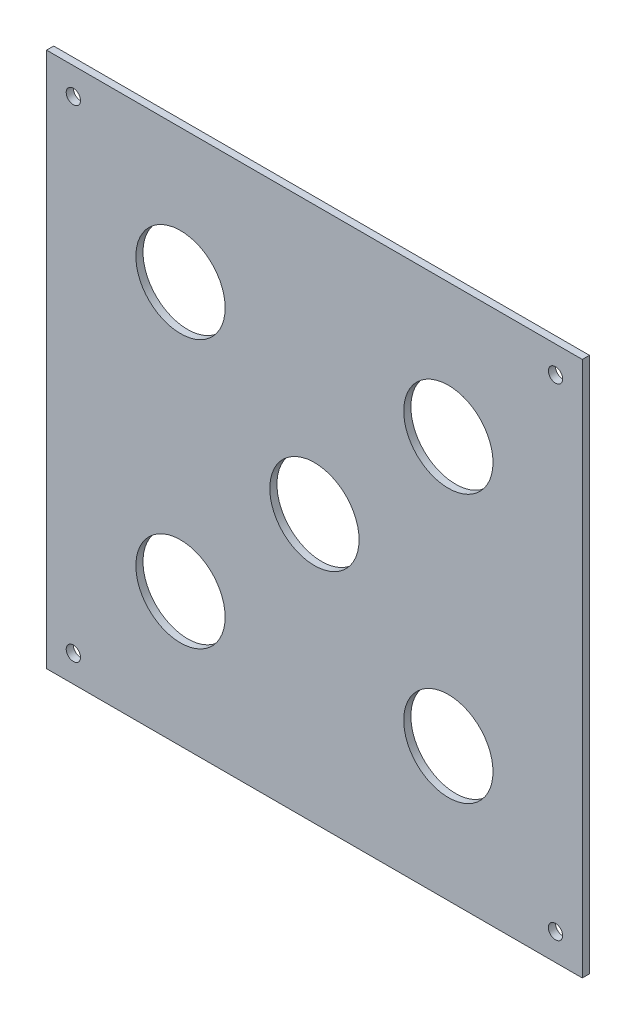
from build123d import *

# Parameters (mm, degrees)
CROQUIS1_W              = 150
CROQUIS1_H              = 150
SALIENTE_EXTRUIR1_DEPTH = 2
CROQUIS3_R              = 2
CROQUIS3_R_2            = 12.5
CORTAR_EXTRUIR2_DEPTH   = 2


with BuildPart() as part:
    # Croquis1 → Saliente-Extruir1 (new body)
    with BuildSketch(Plane.XY):
        Rectangle(CROQUIS1_W, CROQUIS1_H)
    extrude(amount=SALIENTE_EXTRUIR1_DEPTH)

    # Croquis3 → Cortar-Extruir2 (cut)
    with BuildSketch(Plane.XY.offset(2)):
        with Locations((-67.5, -67.5)):
            Circle(CROQUIS3_R)
        with Locations((67.5, -67.5)):
            Circle(CROQUIS3_R)
        with Locations((67.5, 67.5)):
            Circle(CROQUIS3_R)
        with Locations((-67.5, 67.5)):
            Circle(CROQUIS3_R)
        with Locations((-37.5, -37.5)):
            Circle(CROQUIS3_R_2)
        with Locations((37.5, -37.5)):
            Circle(CROQUIS3_R_2)
        with Locations((37.5, 37.5)):
            Circle(CROQUIS3_R_2)
        with Locations((-37.5, 37.5)):
            Circle(CROQUIS3_R_2)
        Circle(CROQUIS3_R_2)
    extrude(amount=-CORTAR_EXTRUIR2_DEPTH, mode=Mode.SUBTRACT)


solid = part.part
